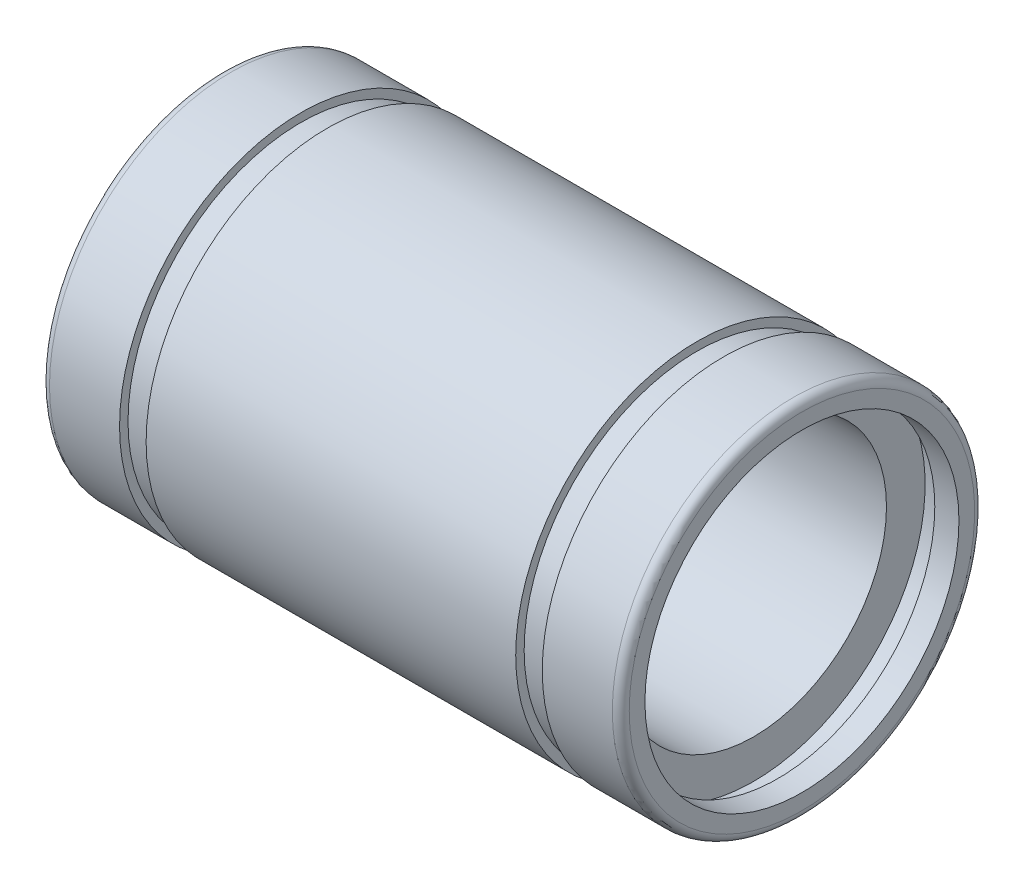
from build123d import *


with BuildPart() as part:
    # Croquis1 → Revolución1 (revolve)
    with BuildSketch(Plane.XY):
        with BuildLine():
            Line((24, 7.15), (24, 6.5))
            Line((24, 6.5), (23, 6.5))
            Line((23, 6.5), (23, 7.1))
            Line((23, 7.1), (22, 7.1))
            Line((22, 7.1), (22, 5.5))
            Line((22, 5.5), (2, 5.5))
            Line((2, 5.5), (2, 6.8))
            Line((2, 6.8), (1, 6.8))
            Line((1, 6.8), (1, 6.5))
            Line((1, 6.5), (0, 6.5))
            Line((0, 6.5), (0, 7.15))
            ThreePointArc((0, 7.15), (0.102512627, 7.397487373), (0.35, 7.5))
            Line((0.35, 7.5), (3.25, 7.5))
            Line((3.25, 7.5), (3.25, 7.15))
            Line((3.25, 7.15), (4.35, 7.15))
            Line((4.35, 7.15), (4.35, 7.5))
            Line((4.35, 7.5), (19.65, 7.5))
            Line((19.65, 7.5), (19.65, 7.15))
            Line((19.65, 7.15), (20.75, 7.15))
            Line((20.75, 7.15), (20.75, 7.5))
            Line((20.75, 7.5), (23.65, 7.5))
            ThreePointArc((23.65, 7.5), (23.897487373, 7.397487373), (24, 7.15))
        make_face()
    revolve(axis=Axis((0, 0, 0), (1, 0, 0)))


solid = part.part
